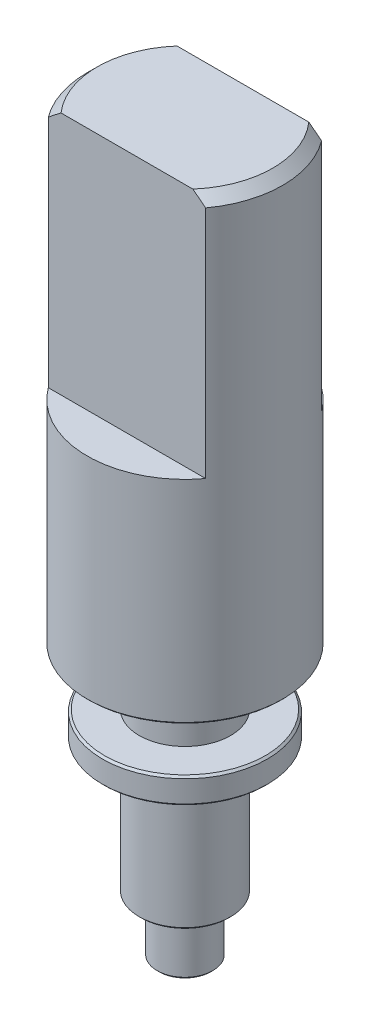
from build123d import *

# Parameters (mm, degrees)
CUT_EXTRUDE_1_DEPTH = 6.15
CHAMFER_1_SIZE      = 0.25
CHAMFER_2_SIZE      = 0.05


with BuildPart() as part:
    # Эскиз1 → Повернуть1 (revolve)
    with BuildSketch(Plane.XY):
        Polygon((0, 18.3), (0, 0), (-0.7, 0), (-0.7, 1.4), (-1.15, 1.4), (-1.15, 4.75), (-2.075, 4.75), (-2.075, 5.4), (-1.15, 5.4), (-1.15, 6.8), (-2.46, 6.8), (-2.46, 18.3), align=None)
    revolve(axis=Axis((0, 18.3, 0), (0, -1, 0)))

    # Эскиз2 → Вырез-Вытянуть1 (cut)
    with BuildSketch(Plane(origin=(0, 18.3, 0), x_dir=(1, 0, 0), z_dir=(0, 1, 0))):
        with BuildLine():
            Line((-1.979898987, 1.46), (1.979898987, 1.46))
            ThreePointArc((1.979898987, 1.46), (0, 2.46), (-1.979898987, 1.46))
        make_face()
        with BuildLine():
            Line((-1.979898987, -1.46), (1.979898987, -1.46))
            ThreePointArc((1.979898987, -1.46), (0, -2.46), (-1.979898987, -1.46))
        make_face()
    extrude(amount=-CUT_EXTRUDE_1_DEPTH, mode=Mode.SUBTRACT)

    # Фаска1
    chamfer_1_edges = [part.edges().sort_by_distance(p)[0] for p in [
        (-2.336894468, 18.3, -0.768455754),
        (2.46, 18.3, 0),
    ]]
    chamfer(chamfer_1_edges, length=CHAMFER_1_SIZE)

    # Фаска2
    chamfer_2_edges = [part.edges().sort_by_distance(p)[0] for p in [
        (0.7, 0, 0),
        (2.075, 5.4, 0),
        (2.075, 4.75, 0),
        (2.46, 6.8, 0),
        (1.15, 1.4, 0),
    ]]
    chamfer(chamfer_2_edges, length=CHAMFER_2_SIZE)


solid = part.part
